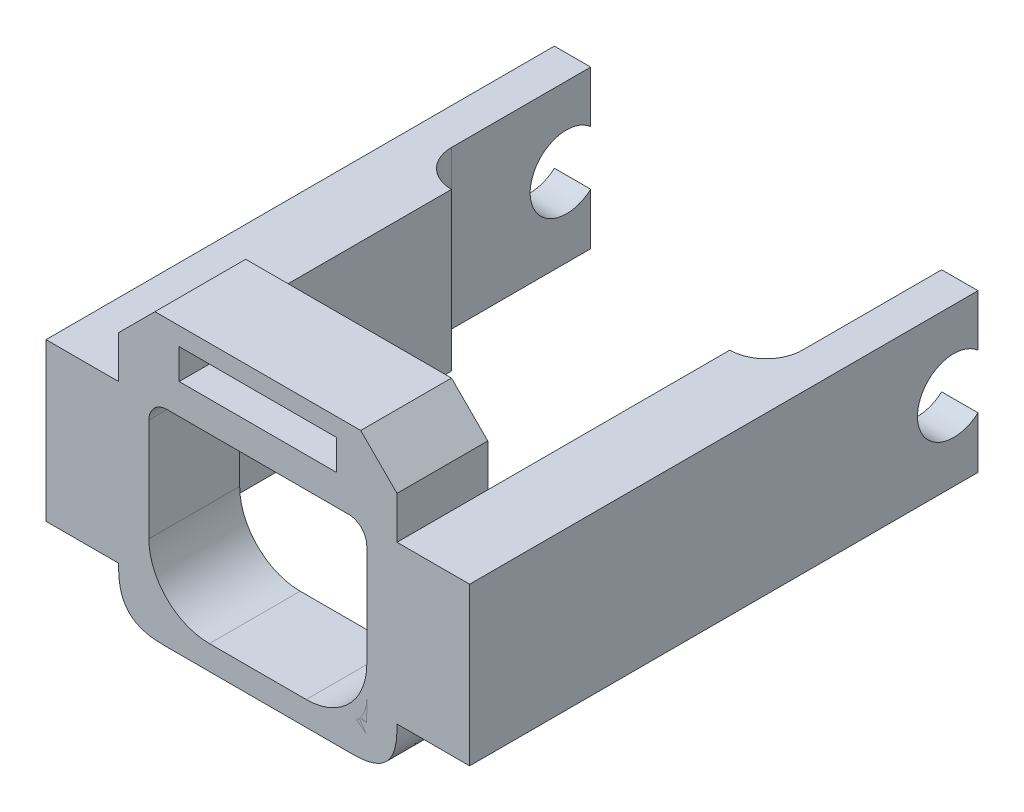
from build123d import *

# Parameters (mm, degrees)
SKETCH1_W            = 23
SKETCH1_H            = 23.5
SKETCH1_W_2          = 18
SKETCH1_H_2          = 15
BOSS_EXTRUDE1_DEPTH  = 7.5
FILLET1_SIZE         = 4
BOSS_EXTRUDE2_DEPTH  = 7.5
BOSS_EXTRUDE3_DEPTH  = 7.5
BOSS_EXTRUDE4_DEPTH  = 7.5
BOSS_EXTRUDE11_DEPTH = 7.5
CHAMFER1_SIZE        = 3
SKETCH8_W            = 13
SKETCH8_H            = 2.5
CUT_EXTRUDE1_DEPTH   = 7.5
BOSS_EXTRUDE12_START = -7.5
SKETCH9_W            = 6
SKETCH9_H            = 13
BOSS_EXTRUDE12_DEPTH = 52.5
SKETCH11_W           = 3
SKETCH11_H           = 13
CUT_EXTRUDE3_DEPTH   = 25
FILLET3_R            = 3
FILLET3_OF_MIRROR7_R = 3
SKETCH12_R           = 3
SKETCH12_W           = 10.5
SKETCH12_H           = 13
CUT_EXTRUDE4_DEPTH   = 60.489494958


# Some blends are built 0.0001 mm under size
with BuildPart() as part:
    # Sketch1 → Boss-Extrude1 (new body)
    with BuildSketch(Plane.XY):
        with Locations((-9, -5.25)):
            Rectangle(SKETCH1_W, SKETCH1_H)
        with Locations((-9, -7.5)):
            Rectangle(SKETCH1_W_2, SKETCH1_H_2, mode=Mode.SUBTRACT)
    extrude(amount=BOSS_EXTRUDE1_DEPTH)

    # Fillet1
    # a fillet whose section is not a circle: 4 mm, written as the material it takes off along each edge
    with BuildSketch(Plane(origin=(-20.5, -17, -10), x_dir=(0, 1, 0), z_dir=(0, 0, 1)), Plane(origin=(2.5, -17, -10), x_dir=(-1, 0, 0), z_dir=(0, 0, 1))) as fillet1_piece_1:
        with BuildLine():
            add(Edge.make_bspline([(FILLET1_SIZE, 0), (FILLET1_SIZE * 0.831801948466, 0), (FILLET1_SIZE * 0.663603896932, 0), (FILLET1_SIZE * 0.292893218813, -FILLET1_SIZE * 0.0716919198361), (FILLET1_SIZE * 0.0716919198361, -FILLET1_SIZE * 0.292893218813), (0, -FILLET1_SIZE * 0.663603896932), (0, -FILLET1_SIZE * 0.831801948466), (0, -FILLET1_SIZE)], knots=[0, 0, 0, 0, 0, 0, 0.5, 0.5, 1, 1, 1, 1, 1, 1], degree=5))
            Line((0, -FILLET1_SIZE), (0, 0))
            Line((0, 0), (FILLET1_SIZE, 0))
        make_face()
    extrude(amount=27.5, mode=Mode.SUBTRACT)

    # Sketch3 → Boss-Extrude2 (add)
    with BuildSketch(Plane.XY.offset(7.5)):
        with BuildLine():
            Line((-16.5, 0), (-18, 0))
            Line((-18, 0), (-18, -1.5))
            ThreePointArc((-18, -1.5), (-17.560660172, -0.439339828), (-16.5, 0))
        make_face()
    extrude(amount=-BOSS_EXTRUDE2_DEPTH)

    # Sketch4 → Boss-Extrude3 (add)
    with BuildSketch(Plane.XY.offset(7.5)):
        with BuildLine():
            Line((0, 0), (0, -1.495394009))
            ThreePointArc((0, -1.495394009), (-0.437990765, -0.437990765), (-1.495394009, 0))
            Line((-1.495394009, 0), (0, 0))
        make_face()
    extrude(amount=-BOSS_EXTRUDE3_DEPTH)

    # Sketch7 → Boss-Extrude11 (add)
    with BuildSketch(Plane.XY.offset(7.5)):
        with BuildLine():
            Line((-18, -15), (-13, -15))
            ThreePointArc((-13, -15), (-16.535533906, -13.535533906), (-18, -10))
            Line((-18, -10), (-18, -15))
        make_face()
        with BuildLine():
            Line((0, -15), (-5, -15))
            ThreePointArc((-5, -15), (-1.464466094, -13.535533906), (0, -10))
            Line((0, -10), (0, -15))
        make_face()
    extrude(amount=-BOSS_EXTRUDE11_DEPTH)

    # Chamfer1
    chamfer1_edges = [part.edges().sort_by_distance(p)[0] for p in [
        (2.5, 6.5, 3.75),
        (-20.5, 6.5, 3.75),
    ]]
    chamfer(chamfer1_edges, length=CHAMFER1_SIZE)

    # Sketch8 → Cut-Extrude1 (cut)
    with BuildSketch(Plane.XY.offset(7.5)):
        with Locations((-9, 3.75)):
            Rectangle(SKETCH8_W, SKETCH8_H)
    extrude(amount=-CUT_EXTRUDE1_DEPTH, mode=Mode.SUBTRACT)

    # Sketch9 → Boss-Extrude12 (add)
    with BuildSketch(Plane(origin=(0, 0, 0), x_dir=(-1, 0, 0), z_dir=(0, 0, -1)).offset(BOSS_EXTRUDE12_START)):
        with Locations((23.5, -6.5)):
            Rectangle(SKETCH9_W, SKETCH9_H)
    boss_extrude12 = extrude(amount=BOSS_EXTRUDE12_DEPTH)

    # Sketch11 → Cut-Extrude3 (cut)
    with BuildSketch(Plane(origin=(0, 0, -45), x_dir=(-1, 0, 0), z_dir=(0, 0, -1))):
        with Locations((22, -6.5)):
            Rectangle(SKETCH11_W, SKETCH11_H)
    cut_extrude3 = extrude(amount=-CUT_EXTRUDE3_DEPTH, mode=Mode.SUBTRACT)

    # Fillet3
    fillet3_edges = [part.edges().sort_by_distance(p)[0] for p in [
        (-23.5, -6.5, -20),
    ]]
    fillet(fillet3_edges, radius=FILLET3_R - 0.0001)  # a hair under: the kernel refuses the full size

    # Mirror7: Boss-Extrude12, Cut-Extrude3 across plane
    add(boss_extrude12.mirror(Plane.ZY.offset(9)))
    add(cut_extrude3.mirror(Plane.ZY.offset(9)), mode=Mode.SUBTRACT)

    # Fillet3 of Mirror7
    fillet3_of_mirror7_edges = [part.edges().sort_by_distance(p)[0] for p in [
        (5.5, -6.5, -20),
    ]]
    fillet(fillet3_of_mirror7_edges, radius=FILLET3_OF_MIRROR7_R - 0.0001)  # a hair under: the kernel refuses the full size

    # Sketch12 → Cut-Extrude4 (cut, through all)
    with BuildSketch(Plane.ZY.offset(26.5)):
        with Locations((-32.5, -6.5)):
            Circle(SKETCH12_R)
        with Locations((-39.75, -6.5)):
            Rectangle(SKETCH12_W, SKETCH12_H)
    extrude(amount=-CUT_EXTRUDE4_DEPTH, mode=Mode.SUBTRACT)


with BuildPart() as body_2:
    # Sketch6 → Boss-Extrude4 (new body)
    with BuildSketch(Plane.XY.offset(7.5)):
        with BuildLine():
            Line((0, -15), (0, -12.5))
            ThreePointArc((0, -12.5), (-0.732233047, -14.267766953), (-2.5, -15))
            Line((-2.5, -15), (0, -15))
        make_face()
    extrude(amount=-BOSS_EXTRUDE4_DEPTH)


solid = Compound([part.part, body_2.part])
